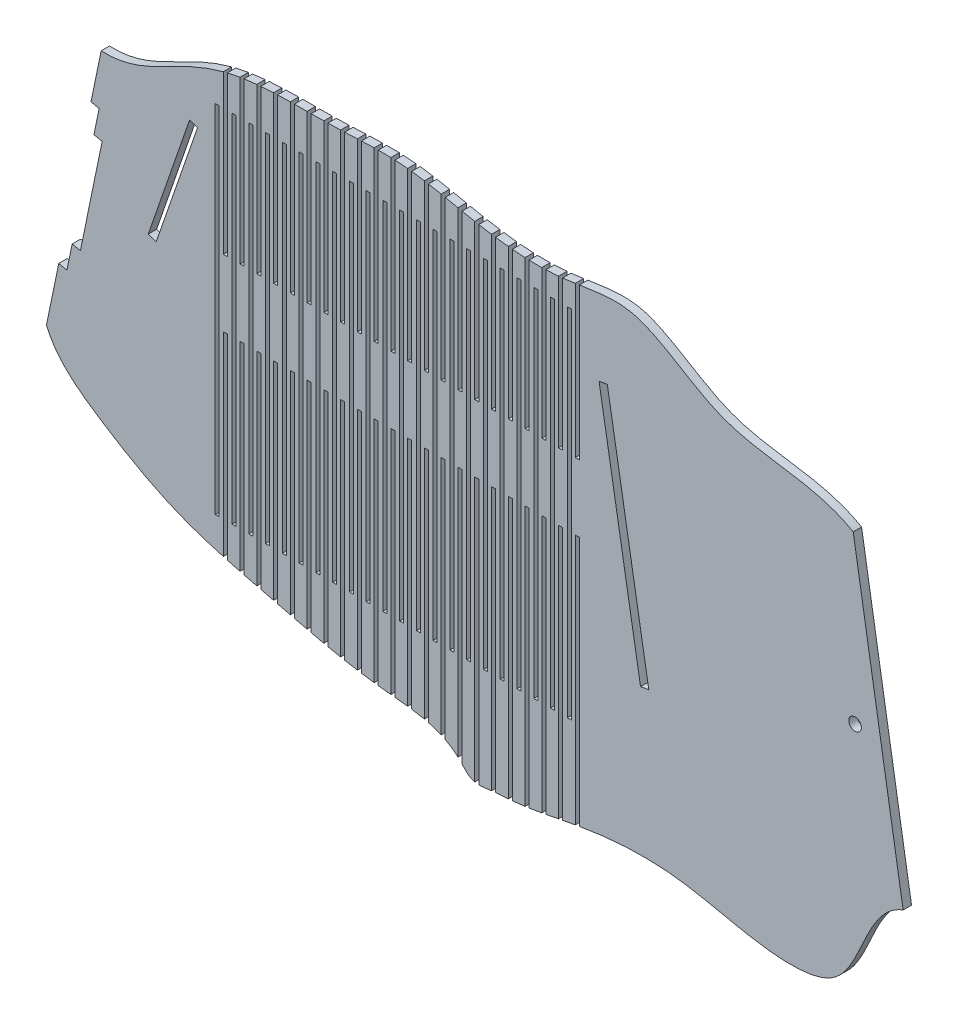
from build123d import *

# Parameters (mm, degrees)
BOSS_EXTRUDE1_DEPTH = 3.175
CUT_EXTRUDE1_DEPTH  = 3.175
SKETCH3_R           = 2.38125
CUT_EXTRUDE2_DEPTH  = 3.175
CAVITY1_START       = 195.372895275
CAVITY1_OUTLINE_W   = 47.957316078
CAVITY1_OUTLINE_H   = 3.175
CAVITY1_DEPTH       = 3.175
CAVITY2_START       = -226.789661262
CAVITY2_OUTLINE_W   = 3.175
CAVITY2_OUTLINE_H   = 3.175
CAVITY2_DEPTH       = 93.636638878
SKETCH4_W           = 1.524
SKETCH4_H           = 134.843104039
SKETCH4_H_2         = 64.548946835
SKETCH4_H_3         = 102.322365483
CUT_EXTRUDE3_DEPTH  = 3.175
LPATTERN1_COUNT     = 22
LPATTERN1_PITCH     = 6.35


with BuildPart() as part:
    # Sketch1 → Boss-Extrude1 (new body)
    with BuildSketch(Plane.XY):
        with BuildLine():
            Line((262.737246002, 224.181878792), (283.441167202, 324.48880736))
            add(Edge.make_bspline(
                [(283.441167202, 324.48880736), (295.742983367, 323.828169482), (309.941701897, 333.714589675), (338.346483616, 344.6122178), (366.29790069, 342.780602234), (397.780951656, 345.644772348), (426.361198573, 338.340387762), (455.754309684, 335.019671894), (479.355731519, 341.831756871), (499.513851572, 333.340495979), (523.37893603, 314.699166662), (553.2232001, 317.98597255), (568.298565769, 309.13934854)],
                knots=[0, 0, 0, 0, 0.120429718, 0.16952599, 0.308073325, 0.399007358, 0.490094812, 0.605497162, 0.700184413, 0.723598703, 0.825579993, 1, 1, 1, 1], degree=3))
            Line((568.298565769, 309.13934854), (587.217666175, 194.553853628))
            add(Edge.make_bspline(
                [(262.737246002, 224.181878792), (266.645652876, 214.756372617), (284.831202664, 201.667981324), (313.267994045, 185.410186066), (350.591507358, 176.601454202), (384.41690883, 167.7239035), (414.124916374, 167.098782086), (423.668686332, 154.405368874), (431.514038605, 155.921936596), (445.452819531, 156.484423585), (468.955277442, 162.457008898), (503.281310954, 164.184848051), (532.541993257, 154.474362166), (571.864062618, 155.8541381), (572.605075551, 189.040207724), (587.217666175, 194.553853628)],
                knots=[0, 0, 0, 0, 0.082301302, 0.179547694, 0.271956218, 0.395767195, 0.478155764, 0.496344528, 0.515086588, 0.53785996, 0.614889523, 0.713576324, 0.815746258, 0.877694955, 1, 1, 1, 1], degree=3))
        make_face()
    extrude(amount=BOSS_EXTRUDE1_DEPTH)

    # Sketch2 → Cut-Extrude1 (cut)
    with BuildSketch(Plane.XY.offset(3.175)):
        Polygon((272.4758652, 255.657230634), (275.585319511, 255.015421559), (283.831749529, 294.9679532), (280.722295219, 295.609762275), (282.699767063, 305.19027242), (279.590312753, 305.832081495), (267.388939044, 246.718529564), (270.498393355, 246.076720489), align=None)
    extrude(amount=-CUT_EXTRUDE1_DEPTH, mode=Mode.SUBTRACT)

    # Sketch3 → Cut-Extrude2 (cut)
    with BuildSketch(Plane.XY.offset(3.175)):
        with Locations((568.998775929, 246.428257545)):
            Circle(SKETCH3_R)
    extrude(amount=-CUT_EXTRUDE2_DEPTH, mode=Mode.SUBTRACT)

    # Cavity1: read off the stored shape, not the designer's step
    # Cavity1 outline → Cavity1 (cut)
    with BuildSketch(Plane(origin=(0, 0, 0), x_dir=(0.3269547204262122, 0.9450400048627664, 0), z_dir=(0.9450400048627664, -0.32695472042621215, 0)).offset(CAVITY1_START)):
        with Locations((380.747098114, 1.5875)):
            Rectangle(CAVITY1_OUTLINE_W, CAVITY1_OUTLINE_H)
    extrude(amount=CAVITY1_DEPTH, mode=Mode.SUBTRACT)

    # Cavity2: read off the stored shape, not the designer's step
    # Cavity2 outline → Cavity2 (cut)
    with BuildSketch(Plane(origin=(0, 0, 0), x_dir=(0.9858207977189934, 0.16780153391637193, 0), z_dir=(0.16780153391637193, -0.9858207977189936, 0)).offset(CAVITY2_START)):
        with Locations((519.015954574, 1.5875)):
            Rectangle(CAVITY2_OUTLINE_W, CAVITY2_OUTLINE_H)
    extrude(amount=CAVITY2_DEPTH, mode=Mode.SUBTRACT)

    # Sketch4 → Cut-Extrude3 (cut)
    with BuildSketch(Plane.XY.offset(3.175)):
        with Locations((327.416359393, 261.418064356)):
            Rectangle(SKETCH4_W, SKETCH4_H)
        with Locations((330.464359393, 313.16193829)):
            Rectangle(SKETCH4_W, SKETCH4_H_2)
        with Locations((330.464359393, 204.326282131)):
            Rectangle(SKETCH4_W, SKETCH4_H_3)
    cut_extrude3 = extrude(amount=-CUT_EXTRUDE3_DEPTH, mode=Mode.SUBTRACT)

    # LPattern1: Cut-Extrude3 ×22
    with Locations(*[(i * LPATTERN1_PITCH, 0, 0) for i in range(1, LPATTERN1_COUNT)]):
        add(cut_extrude3, mode=Mode.SUBTRACT)


solid = part.part
